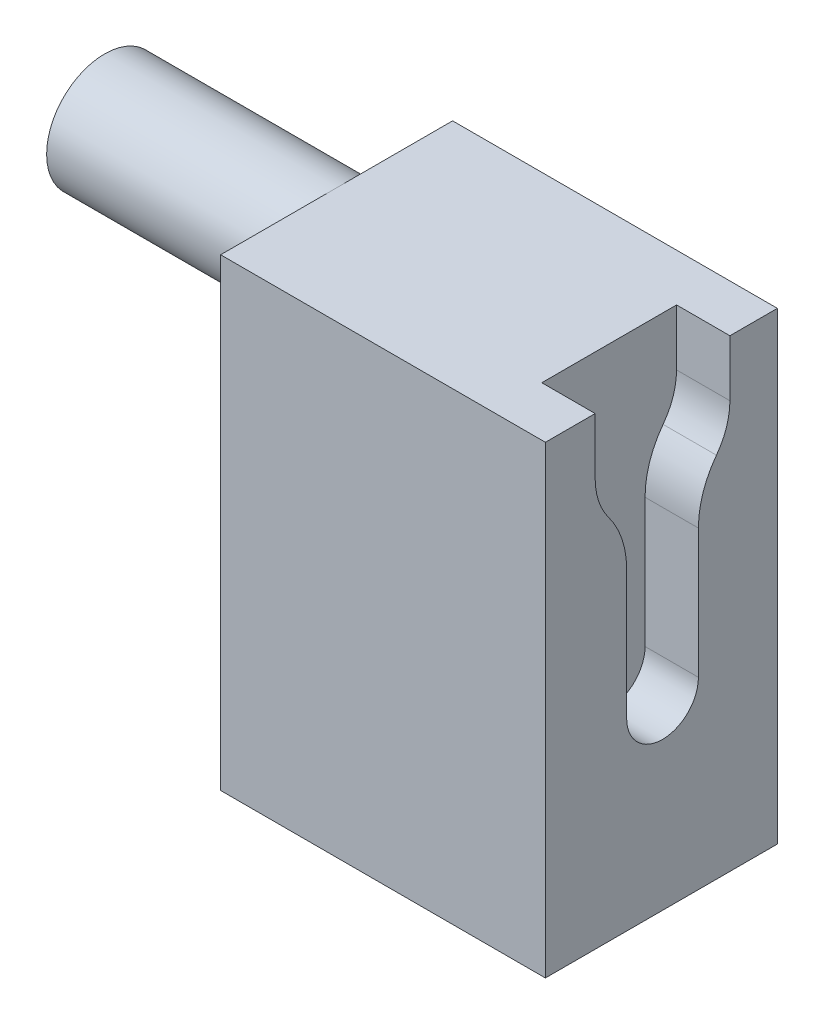
from build123d import *

# Parameters (mm, degrees)
SKETCH1_W           = 35.56
SKETCH1_H           = 25.4
BOSS_EXTRUDE1_DEPTH = 25.4
SKETCH2_R           = 6.35
BOSS_EXTRUDE2_DEPTH = 25.4
CUT_EXTRUDE1_DEPTH  = 5.842


with BuildPart() as part:
    # Sketch1 → Boss-Extrude1 (new, symmetric)
    with BuildSketch(Plane(origin=(0, 0, 0), x_dir=(1, 0, 0), z_dir=(0, 1, 0))):
        Rectangle(SKETCH1_W, SKETCH1_H)
    extrude(amount=BOSS_EXTRUDE1_DEPTH, both=True)

    # Sketch2 → Boss-Extrude2 (add, symmetric)
    with BuildSketch(Plane.ZY.offset(17.78)):
        with Locations((0, 19.05)):
            Circle(SKETCH2_R)
    extrude(amount=BOSS_EXTRUDE2_DEPTH, both=True)

    # Sketch4 → Cut-Extrude1 (cut)
    with BuildSketch(Plane(origin=(17.78, 0, 0), x_dir=(0, 0, -1), z_dir=(1, 0, 0))):
        with BuildLine():
            ThreePointArc((-5.774463067, 14.810979594), (-4.306512866, 12.009296328), (-3.799863067, 8.887179594))
            Line((-3.799863067, 8.887179594), (-3.799863067, -5.262820406))
            ThreePointArc((-3.799863067, -5.262820406), (0.127136933, -9.189820406), (4.054136933, -5.262820406))
            Line((4.054136933, -5.262820406), (4.054136933, 8.887179594))
            ThreePointArc((4.054136933, 8.887179594), (4.560786731, 12.009296328), (6.028736933, 14.810979594))
            ThreePointArc((6.028736933, 14.810979594), (7.125573622, 16.904367364), (7.504136933, 19.237179594))
            Line((7.504136933, 19.237179594), (7.504136933, 26.614179594))
            Line((7.504136933, 26.614179594), (-7.249863067, 26.614179594))
            Line((-7.249863067, 26.614179594), (-7.249863067, 19.237179594))
            ThreePointArc((-7.249863067, 19.237179594), (-6.871299757, 16.904367364), (-5.774463067, 14.810979594))
        make_face()
    extrude(amount=-CUT_EXTRUDE1_DEPTH, mode=Mode.SUBTRACT)


solid = part.part
